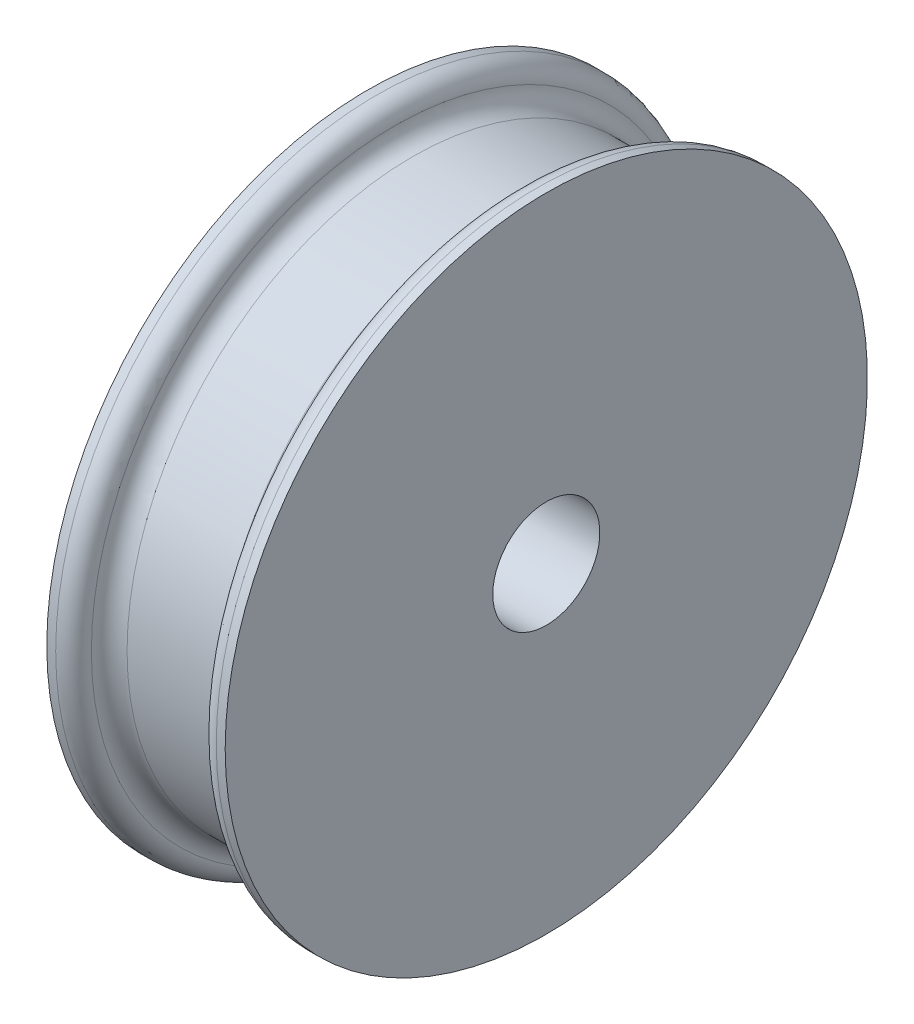
from build123d import *

# Parameters (mm, degrees)
FILLET1_R = 0.5


with BuildPart() as part:
    # Sketch1 → Revolve1 (revolve)
    with BuildSketch(Plane.XY, mode=Mode.PRIVATE) as revolve1_sk:
        with BuildLine():
            Line((-2.5, 1.5), (2.5, 1.5))
            Line((2.5, 1.5), (2.5, 9))
            Line((2.5, 9), (1.75, 9))
            Line((1.75, 9), (1.75, 8.5))
            ThreePointArc((1.75, 8.5), (1.603553391, 8.146446609), (1.25, 8))
            Line((1.25, 8), (-1.25, 8))
            ThreePointArc((-1.25, 8), (-1.603553391, 8.146446609), (-1.75, 8.5))
            Line((-1.75, 8.5), (-1.75, 9))
            Line((-1.75, 9), (-2.5, 9))
            Line((-2.5, 9), (-2.5, 1.5))
        make_face()
    revolve(revolve1_sk.sketch.rotate(Axis((0, 0, 0), (1, 0, 0)), 90), axis=Axis((0, 0, 0), (1, 0, 0)))

    # Fillet1
    fillet1_edges = [part.edges().sort_by_distance(p)[0] for p in [
        (1.75, 0, -9),
        (-1.75, 0, -9),
    ]]
    fillet(fillet1_edges, radius=FILLET1_R - 0.0001)  # a hair under: the kernel refuses the full size


solid = part.part
